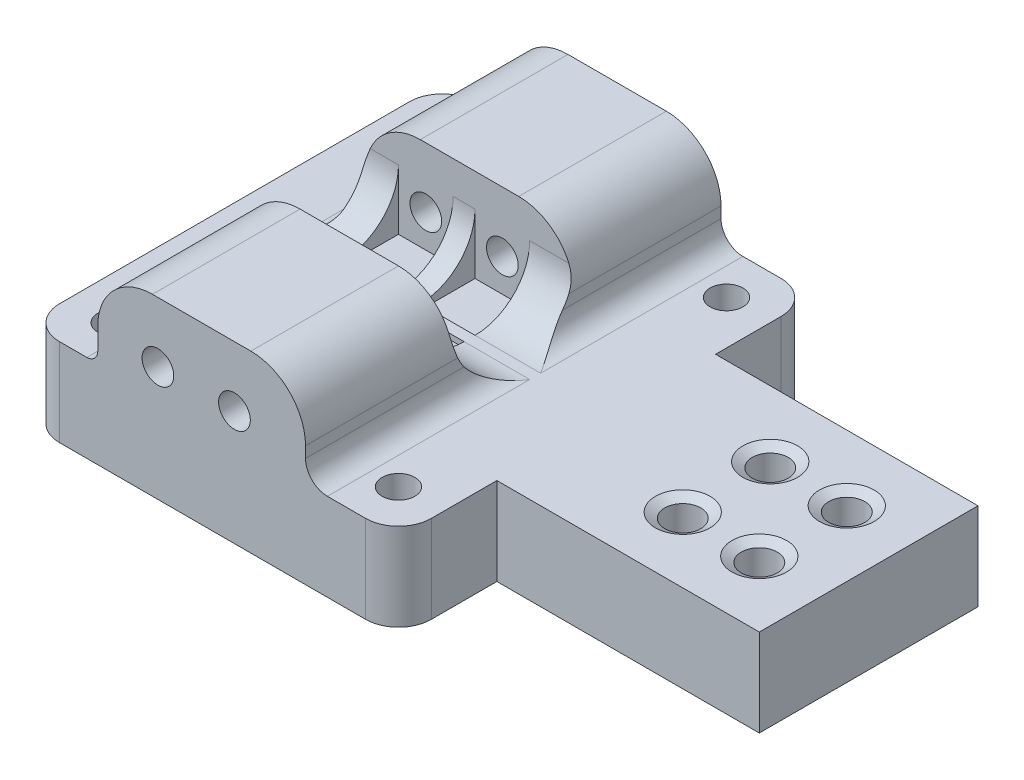
from build123d import *

# Parameters (mm, degrees)
SKETCH1_W                 = 300
SKETCH1_H                 = 20
BOSS_EXTRUDE1_DEPTH       = 8
SKETCH2_W                 = 34
SKETCH2_H                 = 8
BOSS_EXTRUDE2_DEPTH       = 9
SKETCH3_W                 = 34
SKETCH3_H                 = 8
BOSS_EXTRUDE3_DEPTH       = 9
SKETCH4_R                 = 1.5
CUT_EXTRUDE1_DEPTH        = 302.504560496
SKETCH5_W                 = 25
SKETCH5_H                 = 8
BOSS_EXTRUDE4_DEPTH       = 17
SKETCH6_W                 = 25
SKETCH6_H                 = 8
BOSS_EXTRUDE5_DEPTH       = 17
SKETCH12_W                = 8
SKETCH12_H                = 8
BOSS_EXTRUDE7_DEPTH       = 17
BOSS_EXTRUDE8_DEPTH       = 12
SKETCH15_R                = 1.6
CUT_EXTRUDE7_DEPTH        = 20
SKETCH16_W                = 20
SKETCH16_H                = 13
BOSS_EXTRUDE9_DEPTH       = 12
SKETCH17_R                = 1.6
CUT_EXTRUDE8_DEPTH        = 20
SKETCH22_W                = 10
SKETCH22_H                = 38
CUT_EXTRUDE11_DEPTH       = 306.0983448
SKETCH23_W                = 8
SKETCH23_H                = 18
CUT_EXTRUDE12_DEPTH       = 4
BOSS_EXTRUDE12_DEPTH      = 10
BOSS_EXTRUDE13_DEPTH      = 8
SKETCH26_W                = 8
SKETCH26_H                = 48
BOSS_EXTRUDE14_DEPTH      = 14
SKETCH27_W                = 8
SKETCH27_H                = 16
BOSS_EXTRUDE15_DEPTH      = 14
SKETCH28_W                = 8
SKETCH28_H                = 40
CUT_EXTRUDE13_DEPTH       = 14
SKETCH30_W                = 16
SKETCH30_H                = 14
BOSS_EXTRUDE16_DEPTH      = 9
SKETCH31_W                = 17
SKETCH31_H                = 8
CUT_EXTRUDE14_DEPTH       = 5
SKETCH32_W                = 16
SKETCH32_H                = 9
CUT_EXTRUDE15_DEPTH       = 9
CUT_EXTRUDE16_DEPTH       = 10
SKETCH34_W                = 7
SKETCH34_H                = 5
CUT_EXTRUDE17_DEPTH       = 5
SKETCH35_W                = 7
SKETCH35_H                = 5
BOSS_EXTRUDE17_DEPTH      = 5
SKETCH36_R                = 1.7
CUT_EXTRUDE18_DEPTH       = 307.014705529
SKETCH37_W                = 70
SKETCH37_H                = 8
BOSS_EXTRUDE18_DEPTH      = 5
SKETCH39_W                = 66
SKETCH39_H                = 6
CUT_EXTRUDE19_DEPTH       = 306.14258962
SKETCH46_W                = 20
SKETCH46_H                = 12
SKETCH46_W_2              = 19.974984355
BOSS_EXTRUDE23_DEPTH      = 10
BOSS_EXTRUDE24_DEPTH      = 5
BOSS_EXTRUDE24_DEPTH_BACK = 5
SKETCH47_W                = 28
SKETCH47_H                = 12
SKETCH47_W_2              = 28.025015645
SKETCH48_R                = 1.5
CUT_EXTRUDE22_DEPTH       = 15
SKETCH49_R                = 1.45
CUT_EXTRUDE23_DEPTH       = 309.139578763
SKETCH50_W                = 96.54170444
SKETCH50_H                = 99.159492098
CUT_EXTRUDE24_DEPTH       = 245
SKETCH51_R                = 1.65
CUT_EXTRUDE25_DEPTH       = 66.337584896
SKETCH52_W                = 19
SKETCH52_H                = 13.5
BOSS_EXTRUDE25_DEPTH      = 8
FILLET1_R                 = 5
SKETCH53_R                = 1.45
CUT_EXTRUDE26_DEPTH       = 72.161787499
FILLET2_R                 = 5
FILLET3_R                 = 3
SKETCH54_W                = 5
SKETCH54_H                = 5
CUT_EXTRUDE27_DEPTH       = 8.5
FILLET4_R                 = 1
FILLET5_R                 = 2


with BuildPart() as part:
    # Sketch1 → Boss-Extrude1 (new body)
    with BuildSketch(Plane(origin=(0, 0, 0), x_dir=(1, 0, 0), z_dir=(0, 1, 0))):
        with Locations((150, -10)):
            Rectangle(SKETCH1_W, SKETCH1_H)
    extrude(amount=BOSS_EXTRUDE1_DEPTH)

    # Sketch2 → Boss-Extrude2 (add)
    with BuildSketch(Plane.XY.offset(20)):
        with Locations((17, 4)):
            Rectangle(SKETCH2_W, SKETCH2_H)
        with Locations((283, 4)):
            Rectangle(SKETCH2_W, SKETCH2_H)
    extrude(amount=BOSS_EXTRUDE2_DEPTH)

    # Sketch3 → Boss-Extrude3 (add)
    with BuildSketch(Plane(origin=(0, 0, 0), x_dir=(-1, 0, 0), z_dir=(0, 0, -1))):
        with Locations((-17, 4)):
            Rectangle(SKETCH3_W, SKETCH3_H)
        with Locations((-283, 4)):
            Rectangle(SKETCH3_W, SKETCH3_H)
    extrude(amount=BOSS_EXTRUDE3_DEPTH)

    # Sketch4 → Cut-Extrude1 (cut, through all)
    with BuildSketch(Plane(origin=(0, 8, 0), x_dir=(1, 0, 0), z_dir=(0, 1, 0))):
        with Locations(Location((4, 5, 0), (0, 0, 270))):
            Circle(SKETCH4_R)
        with Locations(Location((30, 5, 0), (0, 0, 270))):
            Circle(SKETCH4_R)
        with Locations(Location((30, -25, 0), (0, 0, 270))):
            Circle(SKETCH4_R)
        with Locations(Location((4, -25, 0), (0, 0, 270))):
            Circle(SKETCH4_R)
        with Locations(Location((296, -25, 0), (0, 0, 270))):
            Circle(SKETCH4_R)
        with Locations(Location((296, 5, 0), (0, 0, 270))):
            Circle(SKETCH4_R)
        with Locations(Location((270, -25, 0), (0, 0, 270))):
            Circle(SKETCH4_R)
        with Locations(Location((270, 5, 0), (0, 0, 270))):
            Circle(SKETCH4_R)
    extrude(amount=-CUT_EXTRUDE1_DEPTH, mode=Mode.SUBTRACT)

    # Sketch5 → Boss-Extrude4 (add)
    with BuildSketch(Plane.XY.offset(20)):
        with Locations((253.5, 4)):
            Rectangle(SKETCH5_W, SKETCH5_H)
    extrude(amount=BOSS_EXTRUDE4_DEPTH)

    # Sketch6 → Boss-Extrude5 (add)
    with BuildSketch(Plane(origin=(0, 0, 0), x_dir=(-1, 0, 0), z_dir=(0, 0, -1))):
        with Locations((-253.5, 4)):
            Rectangle(SKETCH6_W, SKETCH6_H)
    extrude(amount=BOSS_EXTRUDE5_DEPTH)

    # Sketch12 → Boss-Extrude7 (add)
    with BuildSketch(Plane.XY.offset(37)):
        with Locations((245, 4)):
            Rectangle(SKETCH12_W, SKETCH12_H)
    extrude(amount=BOSS_EXTRUDE7_DEPTH)

    # Sketch14 → Boss-Extrude8 (add)
    with BuildSketch(Plane.XY.offset(29)):
        Polygon((294.974984355, 8), (275, 8), (275, -4), (294.974984355, -5), align=None)
    extrude(amount=BOSS_EXTRUDE8_DEPTH)

    # Sketch15 → Cut-Extrude7 (cut)
    with BuildSketch(Plane(origin=(294.974984355, 0, 0), x_dir=(0, 0, -1), z_dir=(1, 0, 0))):
        with Locations((-35, 0)):
            Circle(SKETCH15_R)
    extrude(amount=-CUT_EXTRUDE7_DEPTH, mode=Mode.SUBTRACT)

    # Sketch16 → Boss-Extrude9 (add)
    with BuildSketch(Plane(origin=(0, 0, -9), x_dir=(-1, 0, 0), z_dir=(0, 0, -1))):
        with Locations((-285, 1.5)):
            Rectangle(SKETCH16_W, SKETCH16_H)
    extrude(amount=BOSS_EXTRUDE9_DEPTH)

    # Sketch17 → Cut-Extrude8 (cut)
    with BuildSketch(Plane(origin=(295, 0, 0), x_dir=(0, 0, -1), z_dir=(1, 0, 0))):
        with Locations((15, 0)):
            Circle(SKETCH17_R)
    extrude(amount=-CUT_EXTRUDE8_DEPTH, mode=Mode.SUBTRACT)

    # Sketch22 → Cut-Extrude11 (cut, through all)
    with BuildSketch(Plane(origin=(0, 8, 0), x_dir=(1, 0, 0), z_dir=(0, 1, 0))):
        with Locations((254, -10)):
            Rectangle(SKETCH22_W, SKETCH22_H)
    extrude(amount=-CUT_EXTRUDE11_DEPTH, mode=Mode.SUBTRACT)

    # Sketch23 → Cut-Extrude12 (cut)
    with BuildSketch(Plane(origin=(0, 0, 0), x_dir=(-1, 0, 0), z_dir=(0, -1, 0))):
        with Locations((-263, -10)):
            Rectangle(SKETCH23_W, SKETCH23_H)
    extrude(amount=-CUT_EXTRUDE12_DEPTH, mode=Mode.SUBTRACT)

    # Sketch24 → Boss-Extrude12 (add)
    with BuildSketch(Plane.ZY.offset(-259)):
        Polygon((-9, 0), (-9, 8), (-1, 8), align=None)
        Polygon((29, 0), (29, 8), (21, 8), align=None)
    extrude(amount=BOSS_EXTRUDE12_DEPTH)

    # Sketch25 → Boss-Extrude13 (add)
    with BuildSketch(Plane.ZY.offset(-267)):
        Polygon((19, 0), (19, 4), (15, 4), align=None)
        Polygon((1, 4), (5, 4), (1, 0), align=None)
    extrude(amount=BOSS_EXTRUDE13_DEPTH)

    # Sketch26 → Boss-Extrude14 (add)
    with BuildSketch(Plane(origin=(0, 8, 0), x_dir=(1, 0, 0), z_dir=(0, 1, 0))):
        with Locations((245, -30)):
            Rectangle(SKETCH26_W, SKETCH26_H)
    extrude(amount=BOSS_EXTRUDE14_DEPTH)

    # Sketch27 → Boss-Extrude15 (add)
    with BuildSketch(Plane(origin=(0, 8, 0), x_dir=(1, 0, 0), z_dir=(0, 1, 0))):
        with Locations((253, -29)):
            Rectangle(SKETCH27_W, SKETCH27_H)
    extrude(amount=BOSS_EXTRUDE15_DEPTH)

    # Sketch28 → Cut-Extrude13 (cut)
    with BuildSketch(Plane.XZ):
        with Locations((245, 34)):
            Rectangle(SKETCH28_W, SKETCH28_H)
    extrude(amount=-CUT_EXTRUDE13_DEPTH, mode=Mode.SUBTRACT)

    # Sketch30 → Boss-Extrude16 (add)
    with BuildSketch(Plane(origin=(257, 0, 0), x_dir=(0, 0, -1), z_dir=(1, 0, 0))):
        with Locations((-29, 15)):
            Rectangle(SKETCH30_W, SKETCH30_H)
    extrude(amount=BOSS_EXTRUDE16_DEPTH)

    # Sketch31 → Cut-Extrude14 (cut)
    with BuildSketch(Plane(origin=(0, 0, 0), x_dir=(-1, 0, 0), z_dir=(0, -1, 0))):
        with Locations((-257.5, -33)):
            Rectangle(SKETCH31_W, SKETCH31_H)
    extrude(amount=-CUT_EXTRUDE14_DEPTH, mode=Mode.SUBTRACT)

    # Sketch32 → Cut-Extrude15 (cut)
    with BuildSketch(Plane(origin=(266, 0, 0), x_dir=(0, 0, -1), z_dir=(1, 0, 0))):
        with Locations((-29, 17.5)):
            Rectangle(SKETCH32_W, SKETCH32_H)
    extrude(amount=-CUT_EXTRUDE15_DEPTH, mode=Mode.SUBTRACT)

    # Sketch33 → Cut-Extrude16 (cut)
    with BuildSketch(Plane.ZY.offset(-249)):
        Polygon((29, 5), (24, 5), (29, 0), align=None)
    extrude(amount=-CUT_EXTRUDE16_DEPTH, mode=Mode.SUBTRACT)

    # Sketch34 → Cut-Extrude17 (cut)
    with BuildSketch(Plane.XY.offset(29)):
        with Locations((262.5, 2.5)):
            Rectangle(SKETCH34_W, SKETCH34_H)
    extrude(amount=-CUT_EXTRUDE17_DEPTH, mode=Mode.SUBTRACT)

    # Sketch35 → Boss-Extrude17 (add)
    with BuildSketch(Plane(origin=(0, 0, 21), x_dir=(-1, 0, 0), z_dir=(0, 0, -1))):
        with Locations((-262.5, 10.5)):
            Rectangle(SKETCH35_W, SKETCH35_H)
    extrude(amount=BOSS_EXTRUDE17_DEPTH)

    # Sketch36 → Cut-Extrude18 (cut, through all)
    with BuildSketch(Plane(origin=(0, 22, 0), x_dir=(1, 0, 0), z_dir=(0, 1, 0))):
        with Locations(Location((245, -50, 0), (0, 0, 270))):
            Circle(SKETCH36_R)
        with Locations(Location((245, -18, 0), (0, 0, 270))):
            Circle(SKETCH36_R)
    extrude(amount=-CUT_EXTRUDE18_DEPTH, mode=Mode.SUBTRACT)

    # Sketch37 → Boss-Extrude18 (add)
    with BuildSketch(Plane(origin=(0, 8, 0), x_dir=(1, 0, 0), z_dir=(0, 1, 0))):
        with Locations((206, -10)):
            Rectangle(SKETCH37_W, SKETCH37_H)
    extrude(amount=BOSS_EXTRUDE18_DEPTH)

    # Sketch39 → Cut-Extrude19 (cut, through all)
    with BuildSketch(Plane(origin=(0, 8, 0), x_dir=(1, 0, 0), z_dir=(0, 1, 0))):
        with Locations((208, -17)):
            Rectangle(SKETCH39_W, SKETCH39_H)
    extrude(amount=-CUT_EXTRUDE19_DEPTH, mode=Mode.SUBTRACT)

    # Sketch46 → Boss-Extrude23 (add)
    with BuildSketch(Plane(origin=(0, 8, 0), x_dir=(1, 0, 0), z_dir=(0, 1, 0))):
        with Locations((285, 15)):
            Rectangle(SKETCH46_W, SKETCH46_H)
        with Locations((284.987492178, -35)):
            Rectangle(SKETCH46_W_2, SKETCH46_H)
    extrude(amount=BOSS_EXTRUDE23_DEPTH)

    # Sketch47 → Boss-Extrude24 (add, two sides: drawn at the far end of the back side and taken through both)
    with BuildSketch(Plane(origin=(0, 18, 0), x_dir=(1, 0, 0), z_dir=(0, 1, 0)).offset(-BOSS_EXTRUDE24_DEPTH_BACK)):
        with Locations((289, 15)):
            Rectangle(SKETCH47_W, SKETCH47_H)
        with Locations((288.987492178, -35)):
            Rectangle(SKETCH47_W_2, SKETCH47_H)
    extrude(amount=BOSS_EXTRUDE24_DEPTH + BOSS_EXTRUDE24_DEPTH_BACK)

    # Sketch48 → Cut-Extrude22 (cut)
    with BuildSketch(Plane(origin=(303, 0, 0), x_dir=(0, 0, -1), z_dir=(1, 0, 0))):
        with Locations((16, 18)):
            Circle(SKETCH48_R)
        with Locations((-36, 18)):
            Circle(SKETCH48_R)
    extrude(amount=-CUT_EXTRUDE22_DEPTH, mode=Mode.SUBTRACT)

    # Sketch49 → Cut-Extrude23 (cut, through all)
    with BuildSketch(Plane(origin=(0, 8, 0), x_dir=(1, 0, 0), z_dir=(0, 1, 0))):
        with Locations(Location((78, -8, 0), (0, 0, 270))):
            Circle(SKETCH49_R)
        with Locations(Location((78, -12, 0), (0, 0, 270))):
            Circle(SKETCH49_R)
    extrude(amount=-CUT_EXTRUDE23_DEPTH, mode=Mode.SUBTRACT)

    # Sketch50 → Cut-Extrude24 (cut)
    with BuildSketch(Plane(origin=(303, 0, 0), x_dir=(0, 0, -1), z_dir=(1, 0, 0))):
        with Locations((-19.562356109, -1.790710069)):
            Rectangle(SKETCH50_W, SKETCH50_H)
    extrude(amount=-CUT_EXTRUDE24_DEPTH, mode=Mode.SUBTRACT)

    # Sketch51 → Cut-Extrude25 (cut, through all)
    with BuildSketch(Plane(origin=(0, 8, 0), x_dir=(1, 0, 0), z_dir=(0, 1, 0))):
        with Locations(Location((52, -14, 0), (0, 0, 270))):
            Circle(SKETCH51_R)
        with Locations(Location((45, -14, 0), (0, 0, 270))):
            Circle(SKETCH51_R)
        with Locations(Location((45, -6, 0), (0, 0, 270))):
            Circle(SKETCH51_R)
        with Locations(Location((52, -6, 0), (0, 0, 270))):
            Circle(SKETCH51_R)
    extrude(amount=-CUT_EXTRUDE25_DEPTH, mode=Mode.SUBTRACT)

    # Sketch52 → Boss-Extrude25 (add)
    with BuildSketch(Plane(origin=(0, 8, 0), x_dir=(1, 0, 0), z_dir=(0, 1, 0))):
        with Locations((16, 2.25)):
            Rectangle(SKETCH52_W, SKETCH52_H)
        with Locations((16, -22.25)):
            Rectangle(SKETCH52_W, SKETCH52_H)
    extrude(amount=BOSS_EXTRUDE25_DEPTH)

    # Fillet1
    fillet1_edges = [part.edges().sort_by_distance(p)[0] for p in [
        (16, 8, 4.5),
        (16, 8, 15.5),
    ]]
    fillet(fillet1_edges, radius=FILLET1_R)

    # Sketch53 → Cut-Extrude26 (cut, through all)
    with BuildSketch(Plane(origin=(0, 0, -9), x_dir=(-1, 0, 0), z_dir=(0, 0, -1))):
        with Locations((-19, 10.5)):
            Circle(SKETCH53_R)
        with Locations((-12, 10.5)):
            Circle(SKETCH53_R)
    extrude(amount=-CUT_EXTRUDE26_DEPTH, mode=Mode.SUBTRACT)

    # Fillet2
    fillet2_edges = [part.edges().sort_by_distance(p)[0] for p in [
        (25.5, 16, 22.25),
        (6.5, 16, 22.25),
        (6.5, 16, -2.25),
        (25.5, 16, -2.25),
    ]]
    fillet(fillet2_edges, radius=FILLET2_R)

    # Fillet3
    fillet3_edges = [part.edges().sort_by_distance(p)[0] for p in [
        (0, 4, 29),
        (34, 4, 29),
        (0, 4, -9),
        (34, 4, -9),
    ]]
    fillet(fillet3_edges, radius=FILLET3_R)

    # Sketch54 → Cut-Extrude27 (cut)
    with BuildSketch(Plane(origin=(0, 16, 0), x_dir=(1, 0, 0), z_dir=(0, 1, 0))):
        with Locations((19, -7)):
            Rectangle(SKETCH54_W, SKETCH54_H)
        with Locations((12, -7)):
            Rectangle(SKETCH54_W, SKETCH54_H)
        with Locations((19, -13)):
            Rectangle(SKETCH54_W, SKETCH54_H)
        with Locations((12, -13)):
            Rectangle(SKETCH54_W, SKETCH54_H)
    extrude(amount=-CUT_EXTRUDE27_DEPTH, mode=Mode.SUBTRACT)

    # Fillet4
    fillet4_edges = [part.edges().sort_by_distance(p)[0] for p in [
        (6.5, 8, 0.25),
        (6.5, 8, 19.75),
    ]]
    fillet(fillet4_edges, radius=FILLET4_R - 0.0001)  # a hair under: the kernel refuses the full size

    # Fillet5
    fillet5_edges = [part.edges().sort_by_distance(p)[0] for p in [
        (25.5, 8, 0.25),
        (25.5, 8, 19.75),
    ]]
    fillet(fillet5_edges, radius=FILLET5_R)

    # Cut-Extrude28 cone 1 section (through the dimple's axis) → Cut-Extrude28 (revolve, cut)
    with BuildSketch(Plane(origin=(45, 8, 6), x_dir=(0, 0, 1), z_dir=(1, 0, 0))):
        Polygon((0, 0), (2.5, 0), (0, 1.443375673), align=None)
    revolve(axis=Axis((45, 8, 6), (0, -1, 0)), mode=Mode.SUBTRACT)

    # Cut-Extrude28 cone 2 section (through the dimple's axis) → Cut-Extrude28 cone 2 (revolve, cut)
    with BuildSketch(Plane(origin=(52, 8, 6), x_dir=(0, 0, 1), z_dir=(1, 0, 0))):
        Polygon((0, 0), (2.5, 0), (0, 1.443375673), align=None)
    revolve(axis=Axis((52, 8, 6), (0, -1, 0)), mode=Mode.SUBTRACT)

    # Cut-Extrude28 cone 3 section (through the dimple's axis) → Cut-Extrude28 cone 3 (revolve, cut)
    with BuildSketch(Plane(origin=(52, 8, 14), x_dir=(0, 0, 1), z_dir=(1, 0, 0))):
        Polygon((0, 0), (2.5, 0), (0, 1.443375673), align=None)
    revolve(axis=Axis((52, 8, 14), (0, -1, 0)), mode=Mode.SUBTRACT)

    # Cut-Extrude28 cone 4 section (through the dimple's axis) → Cut-Extrude28 cone 4 (revolve, cut)
    with BuildSketch(Plane(origin=(45, 8, 14), x_dir=(0, 0, 1), z_dir=(1, 0, 0))):
        Polygon((0, 0), (2.5, 0), (0, 1.443375673), align=None)
    revolve(axis=Axis((45, 8, 14), (0, -1, 0)), mode=Mode.SUBTRACT)


solid = part.part
